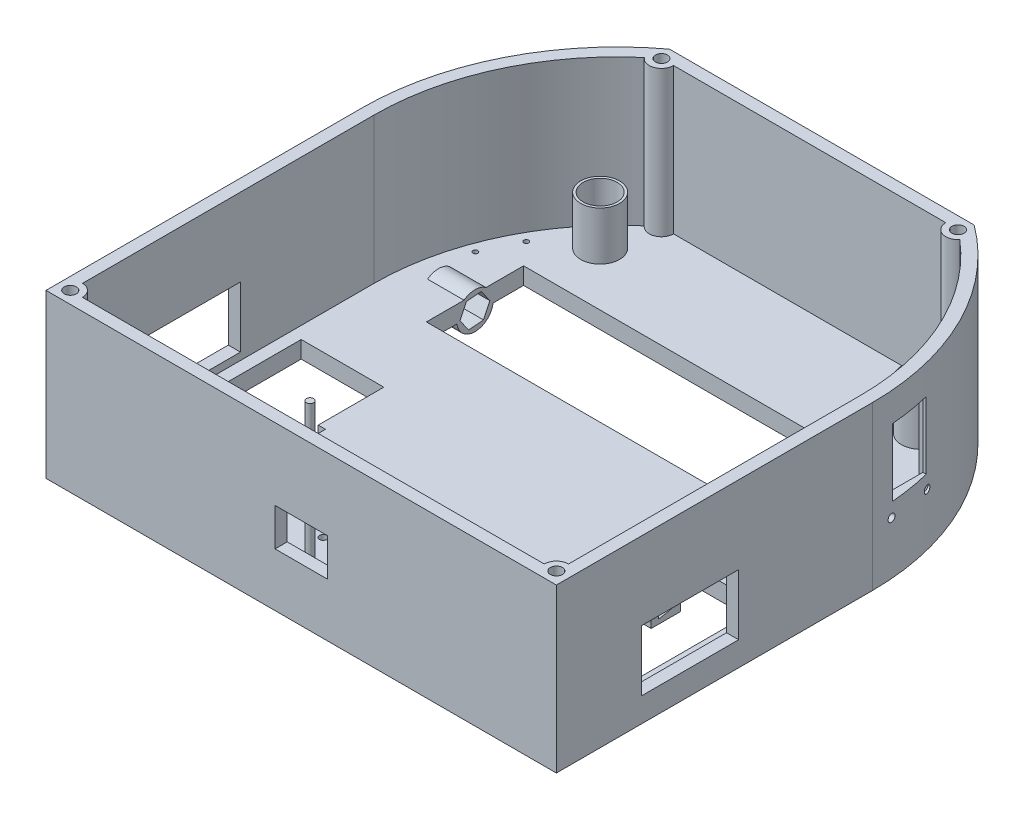
from build123d import *

# Parameters (mm, degrees)
BOSS_EXTRUDE1_DEPTH      = 7
BOSS_EXTRUDE2_DEPTH      = 60
SKETCH4_W                = 34
SKETCH4_H                = 80
CUT_EXTRUDE1_DEPTH       = 100
SKETCH5_W                = 40
SKETCH5_H                = 25
CUT_EXTRUDE2_DEPTH       = 323.201800119
SKETCH6_R                = 8
BOSS_EXTRUDE3_DEPTH      = 20
SKETCH7_R                = 7
CUT_EXTRUDE3_DEPTH       = 318.686952833
SKETCH8_W                = 151
SKETCH8_H                = 40
CUT_EXTRUDE4_DEPTH       = 10
BOSS_EXTRUDE5_REACH      = 324.202
SKETCH9_R                = 5
SKETCH11_R               = 2.5
CUT_EXTRUDE5_DEPTH       = 323.201800119
SKETCH13_R               = 7.5
BOSS_EXTRUDE7_DEPTH      = 15
CUT_EXTRUDE6_DEPTH       = 10
SKETCH15_R               = 1.6
CUT_EXTRUDE7_DEPTH       = 10
SKETCH16_W               = 3
SKETCH16_H               = 26
CUT_EXTRUDE8_DEPTH       = 10
SKETCH17_R               = 1.6
CUT_EXTRUDE9_DEPTH       = 10
SKETCH18_W               = 3
SKETCH18_H               = 26
CUT_EXTRUDE10_DEPTH      = 10
SKETCH20_W               = 29
SKETCH20_H               = 26
CUT_EXTRUDE12_DEPTH      = 3
SKETCH24_W               = 122
SKETCH24_H               = 12
BOSS_EXTRUDE9_DEPTH      = 12
SKETCH26_W               = 9
SKETCH26_H               = 4.8
CUT_EXTRUDE14_DEPTH      = 296.414962383
SKETCH27_R               = 1
CUT_EXTRUDE15_DEPTH      = 10
CUT_EXTRUDE16_START      = -3
SKETCH28_R               = 7.85
SKETCH28_R_2             = 3
SKETCH28_R_3             = 1
CUT_EXTRUDE16_DEPTH      = 3
MIRROR2_COPY_1_SKETCH_R  = 1
MIRROR2_COPY_1_DEPTH     = 10
MIRROR2_COPY_2_SKETCH_R  = 1
MIRROR2_COPY_2_DEPTH     = 10
SKETCH31_R               = 5
BOSS_EXTRUDE11_DEPTH     = 60
SKETCH32_R               = 2.5
CUT_EXTRUDE18_DEPTH      = 325.90921809
FILLET1_R                = 10
SKETCH33_W               = 18.85
SKETCH33_H               = 22.5
CUT_EXTRUDE19_DEPTH      = 10
SKETCH35_W               = 12.4
SKETCH35_H               = 9
CUT_EXTRUDE20_DEPTH      = 35
SKETCH38_W               = 193
SKETCH38_H               = 36.270295723
CUT_EXTRUDE22_DEPTH      = 325.90921809
SKETCH39_W               = 123.69780336
SKETCH39_H               = 5
BOSS_EXTRUDE13_DEPTH     = 60
BOSS_EXTRUDE15_START     = -60
BOSS_EXTRUDE15_OUTLINE_R = 1.5
BOSS_EXTRUDE15_DEPTH     = 60
CUT_EXTRUDE23_REACH      = 312.22
SKETCH42_R               = 2.5
SKETCH43_W               = 4.623270149
SKETCH43_H               = 22.5
CUT_EXTRUDE24_DEPTH      = 50
SKETCH45_R               = 1.55
CUT_EXTRUDE25_DEPTH      = 40
SKETCH47_W               = 21.5
SKETCH47_H               = 15.5
CUT_EXTRUDE26_DEPTH      = 10
SKETCH48_R               = 1.5
CUT_EXTRUDE27_DEPTH      = 28.05
SKETCH49_W               = 16.5
SKETCH49_H               = 27.699851602
CUT_EXTRUDE28_DEPTH      = 305.360832628


# Read off the part's stored shape, not the designer's step: Boss-Extrude15
with BuildPart() as part:
    # Sketch1 → Boss-Extrude1 (new body)
    with BuildSketch(Plane(origin=(0, 0, 0), x_dir=(1, 0, 0), z_dir=(0, 1, 0))):
        with BuildLine():
            ThreePointArc((210, 130), (105, 235), (0, 130))
            Line((0, 130), (210, 130))
        make_face()
        with BuildLine():
            Line((210, 130), (0, 130))
            ThreePointArc((0, 130), (105, 25), (210, 130))
        make_face()
        with BuildLine():
            Line((0, 130), (0, 0))
            Line((0, 0), (210, 0))
            Line((210, 0), (210, 130))
            ThreePointArc((210, 130), (105, 25), (0, 130))
        make_face()
    extrude(amount=BOSS_EXTRUDE1_DEPTH)

    # Sketch3 → Boss-Extrude2 (add)
    with BuildSketch(Plane(origin=(0, 7, 0), x_dir=(1, 0, 0), z_dir=(0, 1, 0))):
        with BuildLine():
            Line((210, 0), (210, 130))
            ThreePointArc((210, 130), (105, 235), (0, 130))
            Line((0, 130), (0, 0))
            Line((0, 0), (210, 0))
        make_face()
        with BuildLine():
            Line((205, 5), (5, 5))
            Line((5, 5), (5, 130))
            ThreePointArc((5, 130), (105, 230), (205, 130))
            Line((205, 130), (205, 5))
        make_face(mode=Mode.SUBTRACT)
    extrude(amount=BOSS_EXTRUDE2_DEPTH)

    # Sketch4 → Cut-Extrude1 (cut)
    with BuildSketch(Plane(origin=(0, 7, 0), x_dir=(1, 0, 0), z_dir=(0, 1, 0))):
        with Locations((27, 55)):
            Rectangle(SKETCH4_W, SKETCH4_H)
        with Locations((183, 55)):
            Rectangle(SKETCH4_W, SKETCH4_H)
    extrude(amount=-CUT_EXTRUDE1_DEPTH, mode=Mode.SUBTRACT)

    # Sketch5 → Cut-Extrude2 (cut, through all)
    with BuildSketch(Plane.ZY):
        with Locations((-55, 22.5)):
            Rectangle(SKETCH5_W, SKETCH5_H)
    extrude(amount=-CUT_EXTRUDE2_DEPTH, mode=Mode.SUBTRACT)

    # Sketch6 → Boss-Extrude3 (add)
    with BuildSketch(Plane(origin=(0, 7, 0), x_dir=(1, 0, 0), z_dir=(0, 1, 0))):
        with Locations(Location((39, 189, 0), (0, 0, 270))):
            Circle(SKETCH6_R)
        with Locations(Location((171, 189, 0), (0, 0, 270))):
            Circle(SKETCH6_R)
    extrude(amount=BOSS_EXTRUDE3_DEPTH)

    # Sketch7 → Cut-Extrude3 (cut, through all)
    with BuildSketch(Plane(origin=(0, 27, 0), x_dir=(1, 0, 0), z_dir=(0, 1, 0))):
        with Locations(Location((39, 189, 0), (0, 0, 270))):
            Circle(SKETCH7_R)
        with Locations(Location((171, 189, 0), (0, 0, 270))):
            Circle(SKETCH7_R)
    extrude(amount=-CUT_EXTRUDE3_DEPTH, mode=Mode.SUBTRACT)

    # Sketch8 → Cut-Extrude4 (cut)
    with BuildSketch(Plane(origin=(0, 7, 0), x_dir=(1, 0, 0), z_dir=(0, 1, 0))):
        with Locations((105, 147)):
            Rectangle(SKETCH8_W, SKETCH8_H)
    extrude(amount=-CUT_EXTRUDE4_DEPTH, mode=Mode.SUBTRACT)

    # Sketch9 → Boss-Extrude5 (add, up to next)
    with BuildSketch(Plane(origin=(0, 67, 0), x_dir=(1, 0, 0), z_dir=(0, 1, 0)), mode=Mode.PRIVATE) as boss_extrude5_sk1:
        with Locations((5, 5)):
            Circle(SKETCH9_R)
    boss_extrude5_tool1 = extrude(boss_extrude5_sk1.sketch, amount=-BOSS_EXTRUDE5_REACH, mode=Mode.PRIVATE) - part.part
    # Sketch9 → Boss-Extrude5 (add, up to next)
    with BuildSketch(Plane(origin=(0, 67, 0), x_dir=(1, 0, 0), z_dir=(0, 1, 0)), mode=Mode.PRIVATE) as boss_extrude5_sk2:
        with Locations((205, 5)):
            Circle(SKETCH9_R)
    boss_extrude5_tool2 = extrude(boss_extrude5_sk2.sketch, amount=-BOSS_EXTRUDE5_REACH, mode=Mode.PRIVATE) - part.part
    add(boss_extrude5_tool1.solids().sort_by_distance((5, 67, -5))[0])
    add(boss_extrude5_tool2.solids().sort_by_distance((205, 67, -5))[0])

    # Sketch11 → Cut-Extrude5 (cut, through all)
    with BuildSketch(Plane(origin=(0, 67, 0), x_dir=(1, 0, 0), z_dir=(0, 1, 0))):
        with Locations(Location((5, 5, 0), (0, 0, 270))):
            Circle(SKETCH11_R)
        with Locations(Location((205, 5, 0), (0, 0, 270))):
            Circle(SKETCH11_R)
    extrude(amount=-CUT_EXTRUDE5_DEPTH, mode=Mode.SUBTRACT)

    # Sketch13 → Boss-Extrude7 (add)
    with BuildSketch(Plane(origin=(29.5, 0, 0), x_dir=(0, 0, -1), z_dir=(1, 0, 0))):
        with Locations((147, 1)):
            Circle(SKETCH13_R)
    extrude(amount=-BOSS_EXTRUDE7_DEPTH)

    # Sketch14 → Cut-Extrude6 (cut)
    with BuildSketch(Plane(origin=(29.5, 0, 0), x_dir=(0, 0, -1), z_dir=(1, 0, 0))):
        Polygon((149.610100053, 6.568651337), (143.482456504, 6.044738621), (140.872356451, 0.476087283), (144.389899947, -4.568651337), (150.517543496, -4.044738621), (153.127643549, 1.523912717), align=None)
    extrude(amount=-CUT_EXTRUDE6_DEPTH, mode=Mode.SUBTRACT)

    # Sketch15 → Cut-Extrude7 (cut)
    with BuildSketch(Plane(origin=(0, 7, 0), x_dir=(1, 0, 0), z_dir=(0, 1, 0))):
        with Locations(Location((53, 63, 0), (0, 0, 270))):
            Circle(SKETCH15_R)
        with Locations(Location((53, 47, 0), (0, 0, 270))):
            Circle(SKETCH15_R)
        with Locations(Location((67, 47, 0), (0, 0, 270))):
            Circle(SKETCH15_R)
        with Locations(Location((67, 63, 0), (0, 0, 270))):
            Circle(SKETCH15_R)
    extrude(amount=-CUT_EXTRUDE7_DEPTH, mode=Mode.SUBTRACT)

    # Sketch16 → Cut-Extrude8 (cut)
    with BuildSketch(Plane(origin=(0, 7, 0), x_dir=(1, 0, 0), z_dir=(0, 1, 0))):
        with Locations((45.5, 55)):
            Rectangle(SKETCH16_W, SKETCH16_H)
    extrude(amount=-CUT_EXTRUDE8_DEPTH, mode=Mode.SUBTRACT)

    # Sketch17 → Cut-Extrude9 (cut)
    with BuildSketch(Plane(origin=(0, 7, 0), x_dir=(1, 0, 0), z_dir=(0, 1, 0))):
        with Locations(Location((157, 63, 0), (0, 0, 270))):
            Circle(SKETCH17_R)
        with Locations(Location((143, 63, 0), (0, 0, 270))):
            Circle(SKETCH17_R)
        with Locations(Location((143, 47, 0), (0, 0, 270))):
            Circle(SKETCH17_R)
        with Locations(Location((157, 47, 0), (0, 0, 270))):
            Circle(SKETCH17_R)
    extrude(amount=-CUT_EXTRUDE9_DEPTH, mode=Mode.SUBTRACT)

    # Sketch18 → Cut-Extrude10 (cut)
    with BuildSketch(Plane(origin=(0, 7, 0), x_dir=(1, 0, 0), z_dir=(0, 1, 0))):
        with Locations((164.5, 55)):
            Rectangle(SKETCH18_W, SKETCH18_H)
    extrude(amount=-CUT_EXTRUDE10_DEPTH, mode=Mode.SUBTRACT)

    # Sketch20 → Cut-Extrude12 (cut)
    with BuildSketch(Plane(origin=(0, 0, 0), x_dir=(-1, 0, 0), z_dir=(0, -1, 0))):
        with Locations((-61.5, 55)):
            Rectangle(SKETCH20_W, SKETCH20_H)
        with Locations((-148.5, 55)):
            Rectangle(SKETCH20_W, SKETCH20_H)
    extrude(amount=-CUT_EXTRUDE12_DEPTH, mode=Mode.SUBTRACT)

    # Sketch24 → Boss-Extrude9 (add)
    with BuildSketch(Plane.XZ):
        with Locations((105, -89)):
            Rectangle(SKETCH24_W, SKETCH24_H)
    extrude(amount=BOSS_EXTRUDE9_DEPTH)

    # Sketch26 → Cut-Extrude14 (cut, through all)
    with BuildSketch(Plane.ZY.offset(-44)):
        with Locations((-90.5, -6)):
            Rectangle(SKETCH26_W, SKETCH26_H)
        Polygon((-86, -3.6), (-86, -1.8), (-95, -3.6), align=None)
        Polygon((-86, -10.2), (-95, -8.4), (-86, -8.4), align=None)
    extrude(amount=-CUT_EXTRUDE14_DEPTH, mode=Mode.SUBTRACT)

    # Sketch27 → Cut-Extrude15 (cut)
    with BuildSketch(Plane(origin=(0, 7, 0), x_dir=(1, 0, 0), z_dir=(0, 1, 0))):
        with Locations(Location((14.617469183, 162.049453652, 0), (0, 0, 270))):
            Circle(SKETCH27_R)
        with Locations(Location((21.420943817, 176.198755151, 0), (0, 0, 270))):
            Circle(SKETCH27_R)
    cut_extrude15 = extrude(amount=-CUT_EXTRUDE15_DEPTH, mode=Mode.SUBTRACT)

    # Mirror1: Cut-Extrude15 across plane
    add(cut_extrude15.mirror(Plane(origin=(105, 0, 0), x_dir=(0, 0, 1), z_dir=(1, 0, 0))), mode=Mode.SUBTRACT)

    # Sketch28 → Cut-Extrude16 (cut)
    # profile 1 of 16: a face of its own
    with BuildSketch(Plane(origin=(0, 0, 0), x_dir=(-1, 0, 0), z_dir=(0, -1, 0)).offset(CUT_EXTRUDE16_START)):
        with Locations((-18.0192065, 169.124104402)):
            Circle(SKETCH28_R)
    # profile 2 of 16: a face of its own
    with BuildSketch(Plane(origin=(0, 0, 0), x_dir=(-1, 0, 0), z_dir=(0, -1, 0)).offset(CUT_EXTRUDE16_START)):
        with Locations((-14.617469183, 162.049453652)):
            Circle(SKETCH28_R_2)
        with Locations(Location((-14.617469183, 162.049453652, 0), (0, 0, 270))):
            Circle(SKETCH28_R_3, mode=Mode.SUBTRACT)
    # profile 3 of 16: a face of its own
    with BuildSketch(Plane(origin=(0, 0, 0), x_dir=(-1, 0, 0), z_dir=(0, -1, 0)).offset(CUT_EXTRUDE16_START)):
        with Locations((-18.0192065, 169.124104402)):
            Circle(SKETCH28_R)
    # profile 4 of 16: a face of its own
    with BuildSketch(Plane(origin=(0, 0, 0), x_dir=(-1, 0, 0), z_dir=(0, -1, 0)).offset(CUT_EXTRUDE16_START)):
        with Locations((-21.420943817, 176.198755151)):
            Circle(SKETCH28_R_2)
        with Locations(Location((-21.420943817, 176.198755151, 0), (0, 0, 270))):
            Circle(SKETCH28_R_3, mode=Mode.SUBTRACT)
    # profile 5 of 16: a face of its own
    with BuildSketch(Plane(origin=(0, 0, 0), x_dir=(-1, 0, 0), z_dir=(0, -1, 0)).offset(CUT_EXTRUDE16_START)):
        with BuildLine():
            ThreePointArc((-18.420943817, 176.198755151), (-18.881250824, 174.60189589), (-20.120916817, 173.495066967))
            Line((-20.120916817, 173.495066967), (-15.917496183, 164.753141837))
            ThreePointArc((-15.917496183, 164.753141837), (-13.90125111, 164.962704701), (-12.212012173, 163.842154568))
            ThreePointArc((-12.212012173, 163.842154568), (-10.697697931, 166.292494919), (-10.1692065, 169.124104402))
            ThreePointArc((-10.1692065, 169.124104402), (-12.647904024, 174.84875371), (-18.518661202, 176.958199436))
            ThreePointArc((-18.518661202, 176.958199436), (-18.445473447, 176.581607704), (-18.420943817, 176.198755151))
        make_face()
    # profile 6 of 16: a face of its own
    with BuildSketch(Plane(origin=(0, 0, 0), x_dir=(-1, 0, 0), z_dir=(0, -1, 0)).offset(CUT_EXTRUDE16_START)):
        with BuildLine():
            Line((-15.917496183, 164.753141837), (-20.120916817, 173.495066967))
            ThreePointArc((-20.120916817, 173.495066967), (-22.13716189, 173.285504103), (-23.826400827, 174.406054236))
            ThreePointArc((-23.826400827, 174.406054236), (-25.09385725, 165.722367085), (-17.519751798, 161.290009368))
            ThreePointArc((-17.519751798, 161.290009368), (-17.340183481, 163.309146809), (-15.917496183, 164.753141837))
        make_face()
    # profile 7 of 16: a face of its own
    with BuildSketch(Plane(origin=(0, 0, 0), x_dir=(-1, 0, 0), z_dir=(0, -1, 0)).offset(CUT_EXTRUDE16_START)):
        with BuildLine():
            ThreePointArc((-18.420943817, 176.198755151), (-18.881250824, 174.60189589), (-20.120916817, 173.495066967))
            Line((-20.120916817, 173.495066967), (-15.917496183, 164.753141837))
            ThreePointArc((-15.917496183, 164.753141837), (-13.90125111, 164.962704701), (-12.212012173, 163.842154568))
            ThreePointArc((-12.212012173, 163.842154568), (-10.697697931, 166.292494919), (-10.1692065, 169.124104402))
            ThreePointArc((-10.1692065, 169.124104402), (-12.647904024, 174.84875371), (-18.518661202, 176.958199436))
            ThreePointArc((-18.518661202, 176.958199436), (-18.445473447, 176.581607704), (-18.420943817, 176.198755151))
        make_face()
    # profile 8 of 16: a face of its own
    with BuildSketch(Plane(origin=(0, 0, 0), x_dir=(-1, 0, 0), z_dir=(0, -1, 0)).offset(CUT_EXTRUDE16_START)):
        with BuildLine():
            Line((-15.917496183, 164.753141837), (-20.120916817, 173.495066967))
            ThreePointArc((-20.120916817, 173.495066967), (-22.13716189, 173.285504103), (-23.826400827, 174.406054236))
            ThreePointArc((-23.826400827, 174.406054236), (-25.09385725, 165.722367085), (-17.519751798, 161.290009368))
            ThreePointArc((-17.519751798, 161.290009368), (-17.340183481, 163.309146809), (-15.917496183, 164.753141837))
        make_face()
    # profile 9 of 16: a face of its own
    with BuildSketch(Plane(origin=(0, 0, 0), x_dir=(-1, 0, 0), z_dir=(0, -1, 0)).offset(CUT_EXTRUDE16_START)):
        with BuildLine():
            ThreePointArc((-20.420943817, 176.198755151), (-20.574379486, 175.666468731), (-20.987601484, 175.297525756))
            Line((-20.987601484, 175.297525756), (-20.120916817, 173.495066967))
            ThreePointArc((-20.120916817, 173.495066967), (-18.881250824, 174.60189589), (-18.420943817, 176.198755151))
            ThreePointArc((-18.420943817, 176.198755151), (-18.445473447, 176.581607704), (-18.518661202, 176.958199436))
            ThreePointArc((-18.518661202, 176.958199436), (-19.518670158, 176.829564073), (-20.493942984, 176.573814419))
            ThreePointArc((-20.493942984, 176.573814419), (-20.439363247, 176.389803792), (-20.420943817, 176.198755151))
        make_face()
    # profile 10 of 16: a face of its own
    with BuildSketch(Plane(origin=(0, 0, 0), x_dir=(-1, 0, 0), z_dir=(0, -1, 0)).offset(CUT_EXTRUDE16_START)):
        with BuildLine():
            Line((-20.120916817, 173.495066967), (-20.987601484, 175.297525756))
            ThreePointArc((-20.987601484, 175.297525756), (-21.721553018, 175.245007748), (-22.292741806, 175.708889591))
            ThreePointArc((-22.292741806, 175.708889591), (-23.101491663, 175.106819298), (-23.826400827, 174.406054236))
            ThreePointArc((-23.826400827, 174.406054236), (-22.13716189, 173.285504103), (-20.120916817, 173.495066967))
        make_face()
    # profile 11 of 16: a face of its own
    with BuildSketch(Plane(origin=(0, 0, 0), x_dir=(-1, 0, 0), z_dir=(0, -1, 0)).offset(CUT_EXTRUDE16_START)):
        with BuildLine():
            ThreePointArc((-20.420943817, 176.198755151), (-20.574379486, 175.666468731), (-20.987601484, 175.297525756))
            Line((-20.987601484, 175.297525756), (-20.120916817, 173.495066967))
            ThreePointArc((-20.120916817, 173.495066967), (-18.881250824, 174.60189589), (-18.420943817, 176.198755151))
            ThreePointArc((-18.420943817, 176.198755151), (-18.445473447, 176.581607704), (-18.518661202, 176.958199436))
            ThreePointArc((-18.518661202, 176.958199436), (-19.518670158, 176.829564073), (-20.493942984, 176.573814419))
            ThreePointArc((-20.493942984, 176.573814419), (-20.439363247, 176.389803792), (-20.420943817, 176.198755151))
        make_face()
    # profile 12 of 16: a face of its own
    with BuildSketch(Plane(origin=(0, 0, 0), x_dir=(-1, 0, 0), z_dir=(0, -1, 0)).offset(CUT_EXTRUDE16_START)):
        with BuildLine():
            Line((-20.120916817, 173.495066967), (-20.987601484, 175.297525756))
            ThreePointArc((-20.987601484, 175.297525756), (-21.721553018, 175.245007748), (-22.292741806, 175.708889591))
            ThreePointArc((-22.292741806, 175.708889591), (-23.101491663, 175.106819298), (-23.826400827, 174.406054236))
            ThreePointArc((-23.826400827, 174.406054236), (-22.13716189, 173.285504103), (-20.120916817, 173.495066967))
        make_face()
    # profile 13 of 16: a face of its own
    with BuildSketch(Plane(origin=(0, 0, 0), x_dir=(-1, 0, 0), z_dir=(0, -1, 0)).offset(CUT_EXTRUDE16_START)):
        with BuildLine():
            ThreePointArc((-12.212012173, 163.842154568), (-13.90125111, 164.962704701), (-15.917496183, 164.753141837))
            Line((-15.917496183, 164.753141837), (-15.050811517, 162.950683047))
            ThreePointArc((-15.050811517, 162.950683047), (-14.316859982, 163.003201055), (-13.745671194, 162.539319212))
            ThreePointArc((-13.745671194, 162.539319212), (-12.936921338, 163.141389506), (-12.212012173, 163.842154568))
        make_face()
    # profile 14 of 16: a face of its own
    with BuildSketch(Plane(origin=(0, 0, 0), x_dir=(-1, 0, 0), z_dir=(0, -1, 0)).offset(CUT_EXTRUDE16_START)):
        with BuildLine():
            Line((-15.050811517, 162.950683047), (-15.917496183, 164.753141837))
            ThreePointArc((-15.917496183, 164.753141837), (-17.340183481, 163.309146809), (-17.519751798, 161.290009368))
            ThreePointArc((-17.519751798, 161.290009368), (-16.519742842, 161.418644731), (-15.544470017, 161.674394385))
            ThreePointArc((-15.544470017, 161.674394385), (-15.55013288, 162.410200696), (-15.050811517, 162.950683047))
        make_face()
    # profile 15 of 16: a face of its own
    with BuildSketch(Plane(origin=(0, 0, 0), x_dir=(-1, 0, 0), z_dir=(0, -1, 0)).offset(CUT_EXTRUDE16_START)):
        with BuildLine():
            ThreePointArc((-12.212012173, 163.842154568), (-13.90125111, 164.962704701), (-15.917496183, 164.753141837))
            Line((-15.917496183, 164.753141837), (-15.050811517, 162.950683047))
            ThreePointArc((-15.050811517, 162.950683047), (-14.316859982, 163.003201055), (-13.745671194, 162.539319212))
            ThreePointArc((-13.745671194, 162.539319212), (-12.936921338, 163.141389506), (-12.212012173, 163.842154568))
        make_face()
    # profile 16 of 16: a face of its own
    with BuildSketch(Plane(origin=(0, 0, 0), x_dir=(-1, 0, 0), z_dir=(0, -1, 0)).offset(CUT_EXTRUDE16_START)):
        with BuildLine():
            Line((-15.050811517, 162.950683047), (-15.917496183, 164.753141837))
            ThreePointArc((-15.917496183, 164.753141837), (-17.340183481, 163.309146809), (-17.519751798, 161.290009368))
            ThreePointArc((-17.519751798, 161.290009368), (-16.519742842, 161.418644731), (-15.544470017, 161.674394385))
            ThreePointArc((-15.544470017, 161.674394385), (-15.55013288, 162.410200696), (-15.050811517, 162.950683047))
        make_face()
    cut_extrude16 = extrude(amount=CUT_EXTRUDE16_DEPTH, mode=Mode.SUBTRACT)

    # Mirror2: Cut-Extrude16 across plane
    add(cut_extrude16.mirror(Plane(origin=(105, 0, 0), x_dir=(0, 0, 1), z_dir=(1, 0, 0))), mode=Mode.SUBTRACT)

    # Mirror2 copy 1 sketch → Mirror2 copy 1 (cut)
    with BuildSketch(Plane(origin=(0, 7, 0), x_dir=(1, 0, 0), z_dir=(0, 1, 0))):
        with Locations(Location((14.617469183, 162.049453652, 0), (0, 0, 270))):
            Circle(MIRROR2_COPY_1_SKETCH_R)
        with Locations(Location((21.420943817, 176.198755151, 0), (0, 0, 270))):
            Circle(MIRROR2_COPY_1_SKETCH_R)
    extrude(amount=-MIRROR2_COPY_1_DEPTH, mode=Mode.SUBTRACT)

    # Mirror2 copy 2 sketch → Mirror2 copy 2 (cut)
    with BuildSketch(Plane(origin=(210, 7, 0), x_dir=(-1, 0, 0), z_dir=(0, 1, 0))):
        with Locations((14.617469183, -162.049453652)):
            Circle(MIRROR2_COPY_2_SKETCH_R)
        with Locations((21.420943817, -176.198755151)):
            Circle(MIRROR2_COPY_2_SKETCH_R)
    extrude(amount=-MIRROR2_COPY_2_DEPTH, mode=Mode.SUBTRACT)

    # Sketch31 → Boss-Extrude11 (add, through all)
    with BuildSketch(Plane(origin=(0, 7, 0), x_dir=(1, 0, 0), z_dir=(0, 1, 0))):
        with Locations((105, 230)):
            Circle(SKETCH31_R)
    extrude(amount=BOSS_EXTRUDE11_DEPTH)

    # Sketch32 → Cut-Extrude18 (cut, through all)
    with BuildSketch(Plane(origin=(0, 67, 0), x_dir=(1, 0, 0), z_dir=(0, 1, 0))):
        with Locations(Location((105, 230, 0), (0, 0, 270))):
            Circle(SKETCH32_R)
    extrude(amount=-CUT_EXTRUDE18_DEPTH, mode=Mode.SUBTRACT)

    # Fillet1
    fillet1_edges = [part.edges().sort_by_distance(p)[0] for p in [
        (105, 0, -83),
    ]]
    fillet(fillet1_edges, radius=FILLET1_R)

    # Sketch33 → Cut-Extrude19 (cut)
    with BuildSketch(Plane(origin=(0, 7, 0), x_dir=(1, 0, 0), z_dir=(0, 1, 0))):
        with Locations((196.125, 147)):
            Rectangle(SKETCH33_W, SKETCH33_H)
    extrude(amount=-CUT_EXTRUDE19_DEPTH, mode=Mode.SUBTRACT)

    # Sketch35 → Cut-Extrude20 (cut)
    with BuildSketch(Plane(origin=(0, 7, 0), x_dir=(1, 0, 0), z_dir=(0, 1, 0))):
        with Locations((180.5, 147)):
            Rectangle(SKETCH35_W, SKETCH35_H)
    extrude(amount=-CUT_EXTRUDE20_DEPTH, mode=Mode.SUBTRACT)

    # Sketch38 → Cut-Extrude22 (cut, through all)
    with BuildSketch(Plane(origin=(0, 67, 0), x_dir=(1, 0, 0), z_dir=(0, 1, 0))):
        with Locations((114.5, 232.367997542)):
            Rectangle(SKETCH38_W, SKETCH38_H)
    extrude(amount=-CUT_EXTRUDE22_DEPTH, mode=Mode.SUBTRACT)

    # Sketch39 → Boss-Extrude13 (add, through all)
    with BuildSketch(Plane(origin=(0, 7, 0), x_dir=(1, 0, 0), z_dir=(0, 1, 0))):
        with Locations((104.160569155, 211.73284968)):
            Rectangle(SKETCH39_W, SKETCH39_H)
    extrude(amount=BOSS_EXTRUDE13_DEPTH)

    # Boss-Extrude15 outline → Boss-Extrude15 (add)
    with BuildSketch(Plane(origin=(0, 67, 0), x_dir=(1, 0, 0), z_dir=(0, 1, 0)).offset(BOSS_EXTRUDE15_START)):
        with BuildLine():
            ThreePointArc((43.990529165, 209.23284968), (42.028776362, 207.682848773), (40.106386726, 206.084288498))
            ThreePointArc((40.106386726, 206.084288498), (45.660751875, 204.520063233), (48.990529165, 209.23284968))
            Line((48.990529165, 209.23284968), (43.990529165, 209.23284968))
        make_face()
        with BuildLine():
            Line((166.009470835, 209.23284968), (161.009470835, 209.23284968))
            ThreePointArc((161.009470835, 209.23284968), (164.339248125, 204.520063233), (169.893613274, 206.084288498))
            ThreePointArc((169.893613274, 206.084288498), (167.971223638, 207.682848773), (166.009470835, 209.23284968))
        make_face()
        with Locations((93.614249714, 15)):
            Circle(BOSS_EXTRUDE15_OUTLINE_R)
    extrude(amount=BOSS_EXTRUDE15_DEPTH)

    # Sketch42 → Cut-Extrude23 (cut, up to next)
    with BuildSketch(Plane(origin=(0, 67, 0), x_dir=(1, 0, 0), z_dir=(0, 1, 0)), mode=Mode.PRIVATE) as cut_extrude23_sk1:
        with Locations(Location((43.990529165, 209.23284968, 0), (0, 0, 270))):
            Circle(SKETCH42_R)
    cut_extrude23_tool1 = extrude(cut_extrude23_sk1.sketch, amount=-CUT_EXTRUDE23_REACH, mode=Mode.PRIVATE) & part.part
    # Sketch42 → Cut-Extrude23 (cut, up to next)
    with BuildSketch(Plane(origin=(0, 67, 0), x_dir=(1, 0, 0), z_dir=(0, 1, 0)), mode=Mode.PRIVATE) as cut_extrude23_sk2:
        with Locations(Location((166.009470835, 209.23284968, 0), (0, 0, 270))):
            Circle(SKETCH42_R)
    cut_extrude23_tool2 = extrude(cut_extrude23_sk2.sketch, amount=-CUT_EXTRUDE23_REACH, mode=Mode.PRIVATE) & part.part
    add(cut_extrude23_tool1.solids().sort_by_distance((43.990529, 67, -209.23285))[0], mode=Mode.SUBTRACT)
    add(cut_extrude23_tool2.solids().sort_by_distance((166.009471, 67, -209.23285))[0], mode=Mode.SUBTRACT)

    # Sketch43 → Cut-Extrude24 (cut)
    with BuildSketch(Plane.XZ.offset(-7)):
        with Locations((203.238364926, -147)):
            Rectangle(SKETCH43_W, SKETCH43_H)
    extrude(amount=-CUT_EXTRUDE24_DEPTH, mode=Mode.SUBTRACT)

    # Sketch45 → Cut-Extrude25 (cut)
    with BuildSketch(Plane.ZY.offset(-205.55)):
        with Locations((-155.75, 21.65)):
            Circle(SKETCH45_R)
        with Locations((-138.25, 21.65)):
            Circle(SKETCH45_R)
    extrude(amount=-CUT_EXTRUDE25_DEPTH, mode=Mode.SUBTRACT)

    # Sketch47 → Cut-Extrude26 (cut)
    with BuildSketch(Plane(origin=(0, 0, -5), x_dir=(-1, 0, 0), z_dir=(0, 0, -1))):
        with Locations((-105, 29.75)):
            Rectangle(SKETCH47_W, SKETCH47_H)
    extrude(amount=-CUT_EXTRUDE26_DEPTH, mode=Mode.SUBTRACT)

    # Sketch48 → Cut-Extrude27 (cut)
    with BuildSketch(Plane(origin=(0, 7, 0), x_dir=(1, 0, 0), z_dir=(0, 1, 0))):
        with Locations(Location((85.05, 29, 0), (0, 0, 270))):
            Circle(SKETCH48_R)
        with Locations(Location((125.05, 10, 0), (0, 0, 270))):
            Circle(SKETCH48_R)
    extrude(amount=-CUT_EXTRUDE27_DEPTH, mode=Mode.SUBTRACT)

    # Sketch49 → Cut-Extrude28 (cut, through all)
    with BuildSketch(Plane.ZY.offset(-205.55)):
        with Locations((-147, 41.150074199)):
            Rectangle(SKETCH49_W, SKETCH49_H)
    extrude(amount=-CUT_EXTRUDE28_DEPTH, mode=Mode.SUBTRACT)


solid = part.part
